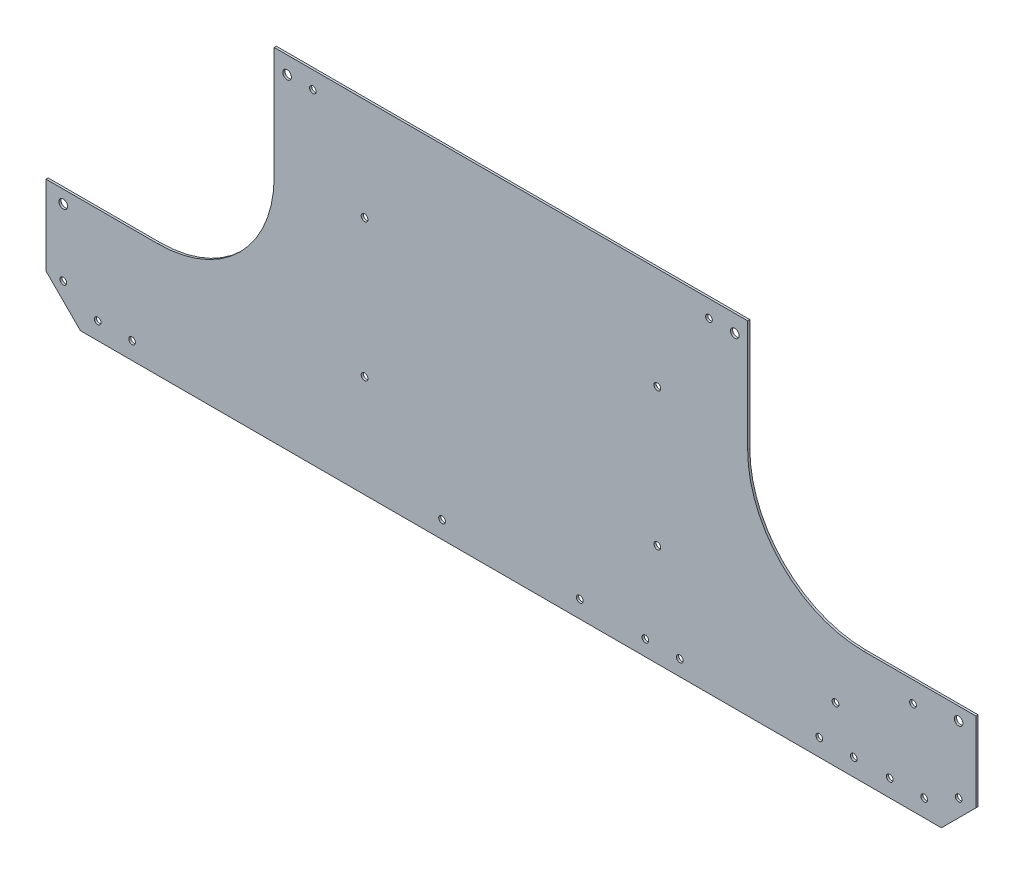
from build123d import *

# Parameters (mm, degrees)
SKETCH3_W                    = 914.4
SKETCH3_H                    = 609.6
BOSS_EXTRUDE1_DEPTH          = 0.79375
SKETCH4_OUTSIDE_W            = 1136.194
SKETCH4_OUTSIDE_H            = 831.394
CUT_EXTRUDE1_DEPTH           = 2.54
CUT_EXTRUDE2_DEPTH           = 2.54
CUT_EXTRUDE3_DEPTH           = 2.54
F_10_0_1935_DIAMETER_HOLE1_D = 4.9149
F_1_4_0_25_DIAMETER_HOLE1_D  = 6.35
F_10_CLEARANCE_HOLE1_D       = 4.9784


with BuildPart() as part:
    # Sketch3 → Boss-Extrude1 (new, symmetric)
    with BuildSketch(Plane.XY):
        Rectangle(SKETCH3_W, SKETCH3_H)
    extrude(amount=BOSS_EXTRUDE1_DEPTH, both=True)

    # Sketch4 outside → Cut-Extrude1 (cut)
    with BuildSketch(Plane.XY.offset(0.79375)):
        Rectangle(SKETCH4_OUTSIDE_W, SKETCH4_OUTSIDE_H)
        with BuildLine():
            Line((-326.734938229, -279.58151343), (-352.134938229, -254.18151343))
            Line((-352.134938229, -254.18151343), (-352.134938229, -29.709012922))
            ThreePointArc((-352.134938229, -29.709012922), (-351.390989453, -27.912961698), (-349.594938229, -27.169012922))
            Line((-349.594938229, -27.169012922), (331.125061771, -27.169012922))
            ThreePointArc((331.125061771, -27.169012922), (332.921112995, -27.912961698), (333.665061771, -29.709012922))
            Line((333.665061771, -29.709012922), (333.665061771, -254.18151343))
            Line((333.665061771, -254.18151343), (308.265061771, -279.58151343))
            Line((308.265061771, -279.58151343), (-326.734938229, -279.58151343))
        make_face(mode=Mode.SUBTRACT)
    extrude(amount=-CUT_EXTRUDE1_DEPTH, mode=Mode.SUBTRACT)

    # Sketch7 → Cut-Extrude2 (cut)
    with BuildSketch(Plane.XY.offset(0.79375)):
        with BuildLine():
            Line((-269.584938229, -195.44401343), (-374.359938229, -195.44401343))
            Line((-374.359938229, -195.44401343), (-374.359938229, -4.94401343))
            Line((-374.359938229, -4.94401343), (-183.859938229, -4.94401343))
            Line((-183.859938229, -4.94401343), (-183.859938229, -109.71901343))
            ThreePointArc((-183.859938229, -109.71901343), (-208.968209412, -170.335742247), (-269.584938229, -195.44401343))
        make_face()
    extrude(amount=-CUT_EXTRUDE2_DEPTH, mode=Mode.SUBTRACT)

    # Sketch8 → Cut-Extrude3 (cut)
    with BuildSketch(Plane.XY.offset(0.79375)):
        with BuildLine():
            Line((251.115061771, -195.44401343), (355.890061771, -195.44401343))
            Line((355.890061771, -195.44401343), (355.890061771, -4.94401343))
            Line((355.890061771, -4.94401343), (165.390061771, -4.94401343))
            Line((165.390061771, -4.94401343), (165.390061771, -109.71901343))
            ThreePointArc((165.390061771, -109.71901343), (190.498332954, -170.335742247), (251.115061771, -195.44401343))
        make_face()
    extrude(amount=-CUT_EXTRUDE3_DEPTH, mode=Mode.SUBTRACT)

    # #10 (0.1935) Diameter Hole1 (through all)
    with Locations(Plane.XY.offset(0.79375)):
        with Locations((-288.634938229, -266.88151343), (-314.034938229, -266.88151343), (-339.434938229, -254.18151343), (89.952061771, -268.113109138), (115.352061771, -268.113109138), (218.222061771, -266.881513934), (243.622061771, -266.881513934), (295.565061771, -266.88151343), (270.165061771, -266.88151343), (320.965061771, -254.18151343), (136.815061771, -39.86901343), (-155.284938737, -39.86901343), (-60.034938737, -266.88151343), (41.565061263, -266.88151343)):
            Hole(F_10_0_1935_DIAMETER_HOLE1_D / 2)

    # 1/4 (0.25) Diameter Hole1 (through all)
    with Locations(Plane.XY.offset(0.79375)):
        with Locations((-339.434938229, -204.969013938), (320.965061771, -204.96901343), (155.865061771, -39.86901343), (-174.334938229, -39.86901343)):
            Hole(F_1_4_0_25_DIAMETER_HOLE1_D / 2)

    # #10 Clearance Hole1 (through all)
    with Locations(Plane.XY.offset(0.79375)):
        with Locations((-117.184938229, -204.17526343), (-117.184938229, -102.57526343), (98.715061771, -102.57526343), (98.715061771, -204.17526343), (230.160061771, -238.78276343), (287.310061771, -210.84276343)):
            Hole(F_10_CLEARANCE_HOLE1_D / 2)


solid = part.part
